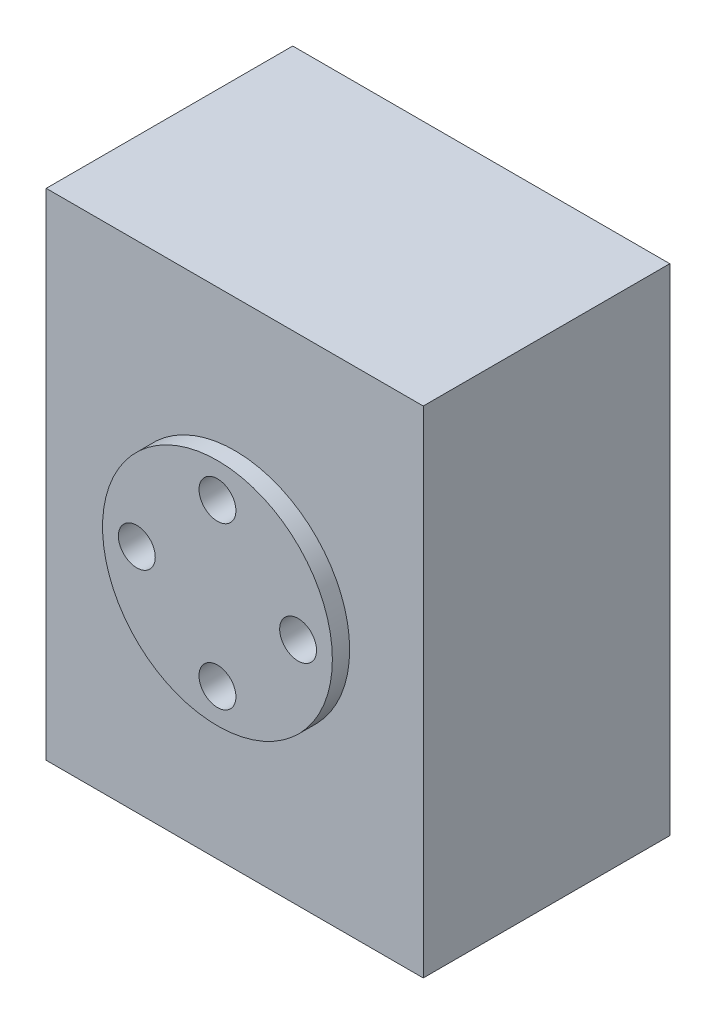
from build123d import *

# Parameters (mm, degrees)
SKETCH1_R           = 9.975
BOSS_EXTRUDE1_DEPTH = 1.5
SKETCH3_W           = 24.73
SKETCH3_H           = 35
BOSS_EXTRUDE4_DEPTH = 2.5
SKETCH3_5_W         = 32.73
SKETCH3_5_H         = 43
SKETCH3_5_W_2       = 24.73
SKETCH3_5_H_2       = 35
BOSS_EXTRUDE5_DEPTH = 21.4
SKETCH4_W           = 5.2
SKETCH4_H           = 1.1
SKETCH4_W_2         = 3.2
SKETCH4_H_2         = 1.5
BOSS_EXTRUDE6_DEPTH = 18.9
SKETCH6_W           = 18.33
SKETCH6_H           = 1.5
BOSS_EXTRUDE7_DEPTH = 5.3
SKETCH2_R           = 1.6
CUT_EXTRUDE1_DEPTH  = 37


with BuildPart() as part:
    # Sketch1 → Boss-Extrude1 (new body)
    with BuildSketch(Plane.XY):
        Circle(SKETCH1_R)
    extrude(amount=BOSS_EXTRUDE1_DEPTH)

    # Sketch3 → Boss-Extrude4 (add)
    with BuildSketch(Plane(origin=(0, 0, 0), x_dir=(-1, 0, 0), z_dir=(0, 0, -1))):
        Rectangle(SKETCH3_W, SKETCH3_H)
    extrude(amount=BOSS_EXTRUDE4_DEPTH)

    # Sketch3<5> → Boss-Extrude5 (add)
    with BuildSketch(Plane(origin=(0, 0, 0), x_dir=(-1, 0, 0), z_dir=(0, 0, -1))):
        Rectangle(SKETCH3_5_W, SKETCH3_5_H)
        Rectangle(SKETCH3_5_W_2, SKETCH3_5_H_2, mode=Mode.SUBTRACT)
    extrude(amount=BOSS_EXTRUDE5_DEPTH)

    # Sketch4 → Boss-Extrude6 (add)
    with BuildSketch(Plane(origin=(0, 0, -2.5), x_dir=(-1, 0, 0), z_dir=(0, 0, -1))):
        with Locations((9.765, 16.95)):
            Rectangle(SKETCH4_W, SKETCH4_H)
        with Locations((-9.765, 16.95)):
            Rectangle(SKETCH4_W, SKETCH4_H)
        with Locations((10.765, -16.75)):
            Rectangle(SKETCH4_W_2, SKETCH4_H_2)
        with Locations((-10.765, -16.75)):
            Rectangle(SKETCH4_W_2, SKETCH4_H_2)
    extrude(amount=BOSS_EXTRUDE6_DEPTH)

    # Sketch6 → Boss-Extrude7 (add)
    with BuildSketch(Plane(origin=(0, 0, -2.5), x_dir=(-1, 0, 0), z_dir=(0, 0, -1))):
        with Locations((0, -16.75)):
            Rectangle(SKETCH6_W, SKETCH6_H)
    extrude(amount=BOSS_EXTRUDE7_DEPTH)

    # Sketch2 → Cut-Extrude1 (cut)
    with BuildSketch(Plane.XY.offset(1.5)):
        with Locations((7, 0)):
            Circle(SKETCH2_R)
        with Locations((0, -7)):
            Circle(SKETCH2_R)
        with Locations((-7, 0)):
            Circle(SKETCH2_R)
        with Locations((0, 7)):
            Circle(SKETCH2_R)
    extrude(amount=-CUT_EXTRUDE1_DEPTH, mode=Mode.SUBTRACT)


solid = part.part
